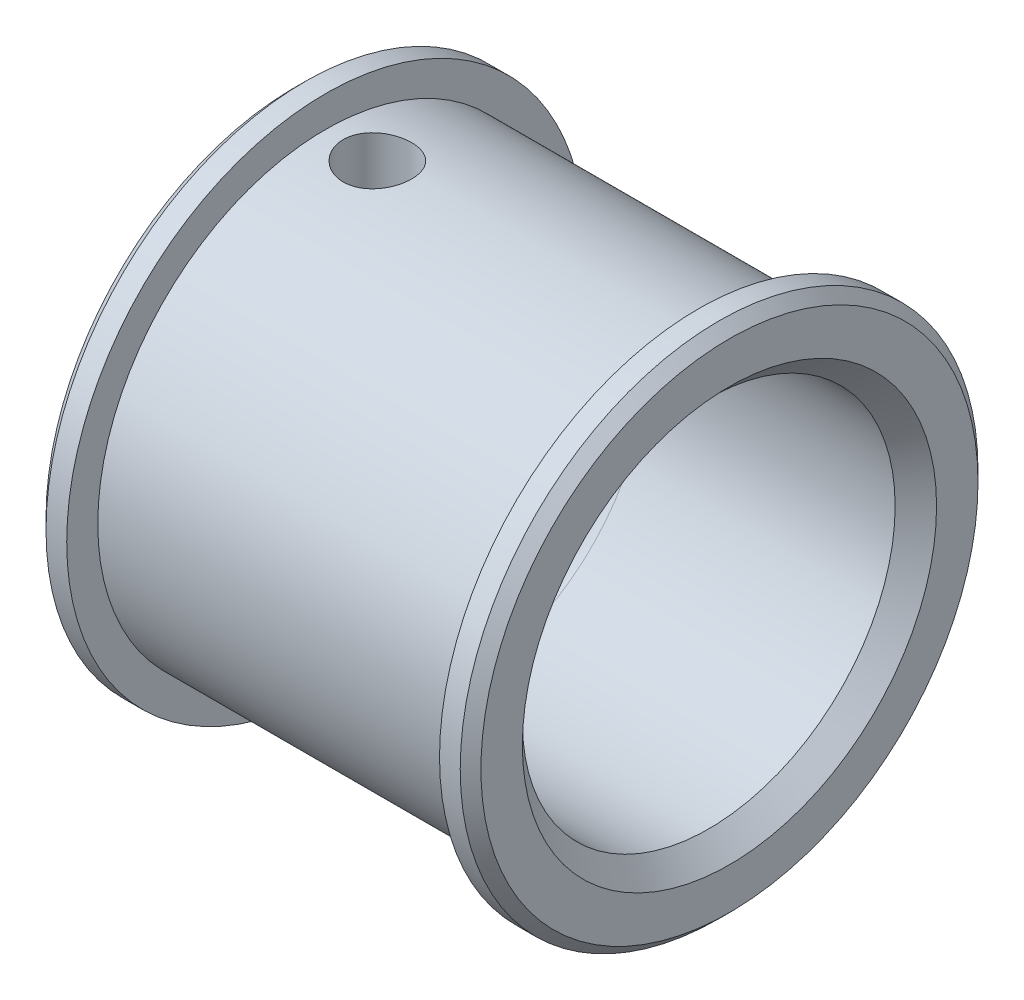
from build123d import *

# Parameters (mm, degrees)
REBAIXO_PARA_PARAFUSO_DE_M_QUINA_DE_CABE_D           = 3
REBAIXO_PARA_PARAFUSO_DE_M_QUINA_DE_CABE_CBORE_D     = 18
REBAIXO_PARA_PARAFUSO_DE_M_QUINA_DE_CABE_CBORE_DEPTH = 14
FURO_DE_DI_METRO_3_3_3_3_1_OUTLINE_R                 = 1.65
FURO_DE_DI_METRO_3_3_3_3_1_DEPTH                     = 11.000000058
CHANFRO1_SIZE                                        = 0.5
CHANFRO2_SIZE                                        = 1
FILETE1_R                                            = 1


# Read off the part's stored shape, not the designer's step: Furo de diâmetro Ø3.3 (3.3)1
with BuildPart() as part:
    # Esboço1 → Revolução1 (revolve)
    with BuildSketch(Plane(origin=(0, 0, 0), x_dir=(-1, 0, 0), z_dir=(0, 0, -1)), mode=Mode.PRIVATE) as revolu_o1_sk:
        Polygon((-10.5, 12.5), (-10.5, 0), (10.5, 0), (10.5, 12.5), (9, 12.5), (9, 11), (-9, 11), (-9, 12.5), align=None)
    revolve(revolu_o1_sk.sketch.rotate(Axis((10.5, 0, 0), (-1, 0, 0)), 270), axis=Axis((10.5, 0, 0), (-1, 0, 0)))

    # Rebaixo para parafuso de máquina de cabeça sextavada de M2.51 (through all)
    with Locations(Plane(origin=(10.5, 0, 0), x_dir=(0, 0, -1), z_dir=(1, 0, 0))):
        with Locations((0, 0)):
            CounterBoreHole(REBAIXO_PARA_PARAFUSO_DE_M_QUINA_DE_CABE_D / 2, REBAIXO_PARA_PARAFUSO_DE_M_QUINA_DE_CABE_CBORE_D / 2, REBAIXO_PARA_PARAFUSO_DE_M_QUINA_DE_CABE_CBORE_DEPTH)

    # Furo de diâmetro Ø3.3 (3.3)1 outline → Furo de diâmetro Ø3.3 (3.3)1 (cut)
    with BuildSketch(Plane(origin=(0, 0, 0), x_dir=(1, 0, 0), z_dir=(0, 1, 0))):
        with Locations((-6.5, 0)):
            Circle(FURO_DE_DI_METRO_3_3_3_3_1_OUTLINE_R)
    extrude(amount=FURO_DE_DI_METRO_3_3_3_3_1_DEPTH, mode=Mode.SUBTRACT)

    # Chanfro1
    chanfro1_edges = [part.edges().sort_by_distance(p)[0] for p in [
        (10.5, 0, -12.5),
        (-10.5, 0, -12.5),
    ]]
    chamfer(chanfro1_edges, length=CHANFRO1_SIZE)

    # Chanfro2
    chanfro2_edges = [part.edges().sort_by_distance(p)[0] for p in [
        (10.5, 0, 9),
    ]]
    chamfer(chanfro2_edges, length=CHANFRO2_SIZE)

    # Filete1
    filete1_edges = [part.edges().sort_by_distance(p)[0] for p in [
        (-3.5, 0, 9),
    ]]
    fillet(filete1_edges, radius=FILETE1_R)


solid = part.part
